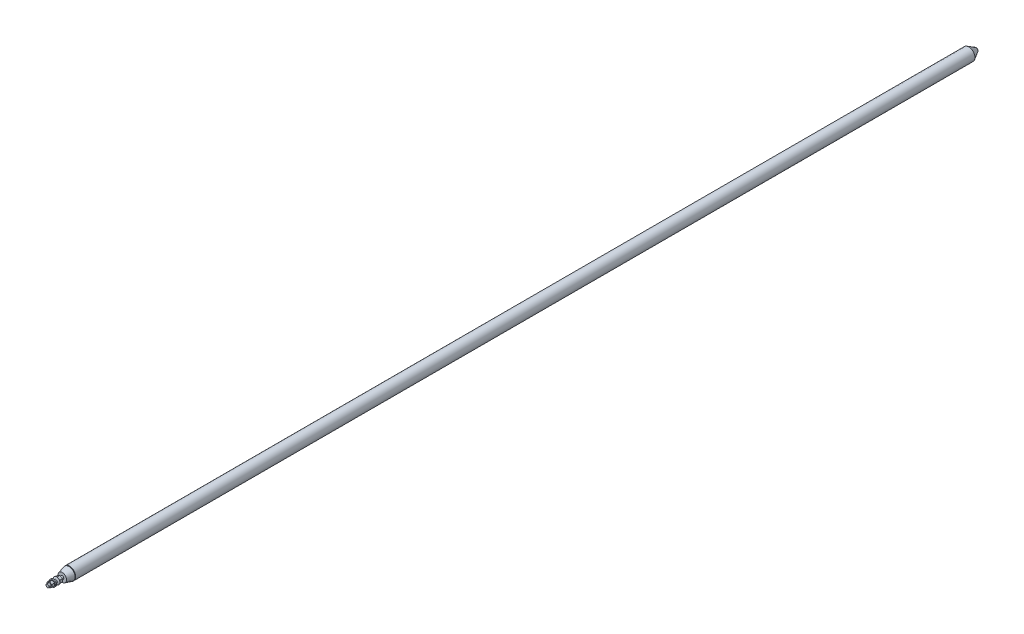
from build123d import *

# Parameters (mm, degrees)
BOSS_REVOLVE3_START         = 12.690475
BOSS_REVOLVE3_OUTLINE_R     = 7.9375
BOSS_REVOLVE3_DEPTH         = 15.478125
BOSS_REVOLVE3_START_2       = 46.292398399
BOSS_REVOLVE3_2_OUTLINE_R   = 16.6751
BOSS_REVOLVE3_2_OUTLINE_R_2 = 7.9375
BOSS_REVOLVE3_2_DEPTH       = 5.8166
BOSS_EXTRUDE2_DEPTH         = 13.890625


# Read off the part's stored shape, not the designer's step: Boss-Revolve3
with BuildPart() as part:
    # Sketch1 → Base-Revolve (revolve)
    with BuildSketch(Plane(origin=(0, 0, 0), x_dir=(0, 0, -1), z_dir=(1, 0, 0)), mode=Mode.PRIVATE) as base_revolve_sk:
        Polygon((-76.2, 0), (-76.2, 7.9375), (0, 7.9375), (0, 22.225), (34.895210283, 31.75), (38.1, 28.575), (47.625, 28.575), (47.625, 0), align=None)
    revolve(base_revolve_sk.sketch.rotate(Axis((0, 0, 0), (0, 0, 1)), 90), axis=Axis((0, 0, 0), (0, 0, 1)))

    # Sketch3 → Boss-Revolve2 (revolve)
    with BuildSketch(Plane(origin=(0, 0, 0), x_dir=(0, 0, -1), z_dir=(1, 0, 0)), mode=Mode.PRIVATE) as boss_revolve2_sk:
        with BuildLine():
            Line((-28.1686, 0), (-28.1686, 17.4625))
            Line((-28.1686, 17.4625), (-29.7688, 17.4625))
            ThreePointArc((-29.7688, 17.4625), (-33.309963658, 9.048473715), (-34.5186, 0))
            Line((-34.5186, 0), (-28.1686, 0))
        make_face()
    revolve(boss_revolve2_sk.sketch.rotate(Axis((0, 0, 0), (0, 0, 1)), 90), axis=Axis((0, 0, 0), (0, 0, 1)))

    # Sketch2 → Boss-Revolve1 (revolve)
    with BuildSketch(Plane(origin=(0, 0, 0), x_dir=(0, 0, -1), z_dir=(1, 0, 0)), mode=Mode.PRIVATE) as boss_revolve1_sk:
        with BuildLine():
            Line((38.1, 31.75), (38.1, 28.5623))
            Line((38.1, 28.5623), (4699.39623629, 28.5623))
            Line((4699.39623629, 28.5623), (4699.39623629, 0))
            Line((4699.39623629, 0), (4741.68884943, 0))
            ThreePointArc((4741.68884943, 0), (4739.987372059, 6.35), (4735.33884943, 10.998522628))
            Line((4735.33884943, 10.998522628), (4699.39623629, 31.75))
            Line((4699.39623629, 31.75), (38.1, 31.75))
        make_face()
    revolve(boss_revolve1_sk.sketch.rotate(Axis((0, 0, 29.7434), (0, 0, -1)), 90), axis=Axis((0, 0, 29.7434), (0, 0, -1)))

    # Boss-Revolve3 outline → Boss-Revolve3 (add)
    with BuildSketch(Plane.XY.offset(BOSS_REVOLVE3_START)):
        Polygon((0, -15.588572738), (13.5001, -7.794286369), (13.5001, 7.794286369), (0, 15.588572738), (-13.5001, 7.794286369), (-13.5001, -7.794286369), align=None)
        Circle(BOSS_REVOLVE3_OUTLINE_R, mode=Mode.SUBTRACT)
    extrude(amount=BOSS_REVOLVE3_DEPTH)

    # Boss-Revolve3 2 outline → Boss-Revolve3 2 (add)
    with BuildSketch(Plane.XY.offset(BOSS_REVOLVE3_START_2)):
        Circle(BOSS_REVOLVE3_2_OUTLINE_R)
        Circle(BOSS_REVOLVE3_2_OUTLINE_R_2, mode=Mode.SUBTRACT)
    extrude(amount=BOSS_REVOLVE3_2_DEPTH)

    # Sketch6 → Boss-Extrude2 (add)
    with BuildSketch(Plane.XY.offset(52.108998399)):
        Polygon((0, -13.755485633), (11.9126, -6.877742817), (11.9126, 6.877742817), (0, 13.755485633), (-11.9126, 6.877742817), (-11.9126, -6.877742817), align=None)
    extrude(amount=BOSS_EXTRUDE2_DEPTH)


solid = part.part
